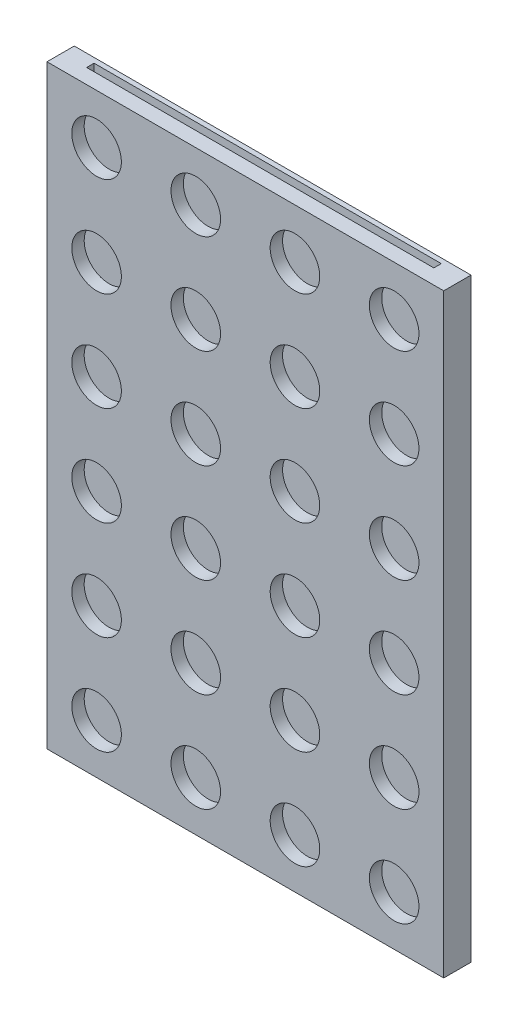
from build123d import *

# Parameters (mm, degrees)
SKETCH1_W           = 101.6
SKETCH1_H           = 152.4
BOSS_EXTRUDE1_DEPTH = 6.985
SKETCH3_R           = 6.35
CUT_EXTRUDE2_DEPTH  = 3.175
SKETCH5_W           = 88.9
SKETCH5_H           = 1.905
CUT_EXTRUDE3_DEPTH  = 146.05
SKETCH4_W           = 86.36
SKETCH4_H           = 137.16
CUT_EXTRUDE4_DEPTH  = 2.54


with BuildPart() as part:
    # Sketch1 → Boss-Extrude1 (new body)
    with BuildSketch(Plane.XY):
        with Locations((50.8, 76.2)):
            Rectangle(SKETCH1_W, SKETCH1_H)
    extrude(amount=BOSS_EXTRUDE1_DEPTH)

    # Sketch3 → Cut-Extrude2 (cut)
    with BuildSketch(Plane.XY.offset(6.985)):
        with Locations((12.7, 139.7)):
            Circle(SKETCH3_R)
        with Locations((38.1, 139.7)):
            Circle(SKETCH3_R)
        with Locations((63.5, 139.7)):
            Circle(SKETCH3_R)
        with Locations((88.9, 139.7)):
            Circle(SKETCH3_R)
        with Locations((88.9, 114.3)):
            Circle(SKETCH3_R)
        with Locations((63.5, 114.3)):
            Circle(SKETCH3_R)
        with Locations((38.1, 114.3)):
            Circle(SKETCH3_R)
        with Locations((12.7, 114.3)):
            Circle(SKETCH3_R)
        with Locations((88.9, 88.9)):
            Circle(SKETCH3_R)
        with Locations((63.5, 88.9)):
            Circle(SKETCH3_R)
        with Locations((38.1, 88.9)):
            Circle(SKETCH3_R)
        with Locations((12.7, 88.9)):
            Circle(SKETCH3_R)
        with Locations((88.9, 63.5)):
            Circle(SKETCH3_R)
        with Locations((63.5, 63.5)):
            Circle(SKETCH3_R)
        with Locations((38.1, 63.5)):
            Circle(SKETCH3_R)
        with Locations((12.7, 63.5)):
            Circle(SKETCH3_R)
        with Locations((88.9, 38.1)):
            Circle(SKETCH3_R)
        with Locations((63.5, 38.1)):
            Circle(SKETCH3_R)
        with Locations((38.1, 38.1)):
            Circle(SKETCH3_R)
        with Locations((12.7, 38.1)):
            Circle(SKETCH3_R)
        with Locations((88.9, 12.7)):
            Circle(SKETCH3_R)
        with Locations((63.5, 12.7)):
            Circle(SKETCH3_R)
        with Locations((38.1, 12.7)):
            Circle(SKETCH3_R)
        with Locations((12.7, 12.7)):
            Circle(SKETCH3_R)
    extrude(amount=-CUT_EXTRUDE2_DEPTH, mode=Mode.SUBTRACT)

    # Sketch5 → Cut-Extrude3 (cut)
    with BuildSketch(Plane(origin=(0, 152.4, 0), x_dir=(1, 0, 0), z_dir=(0, 1, 0))):
        with Locations((50.8, -2.2225)):
            Rectangle(SKETCH5_W, SKETCH5_H)
    extrude(amount=-CUT_EXTRUDE3_DEPTH, mode=Mode.SUBTRACT)

    # Sketch4 → Cut-Extrude4 (cut)
    with BuildSketch(Plane(origin=(0, 0, 0), x_dir=(-1, 0, 0), z_dir=(0, 0, -1))):
        with Locations((-50.8, 76.2)):
            Rectangle(SKETCH4_W, SKETCH4_H)
    extrude(amount=-CUT_EXTRUDE4_DEPTH, mode=Mode.SUBTRACT)


solid = part.part
